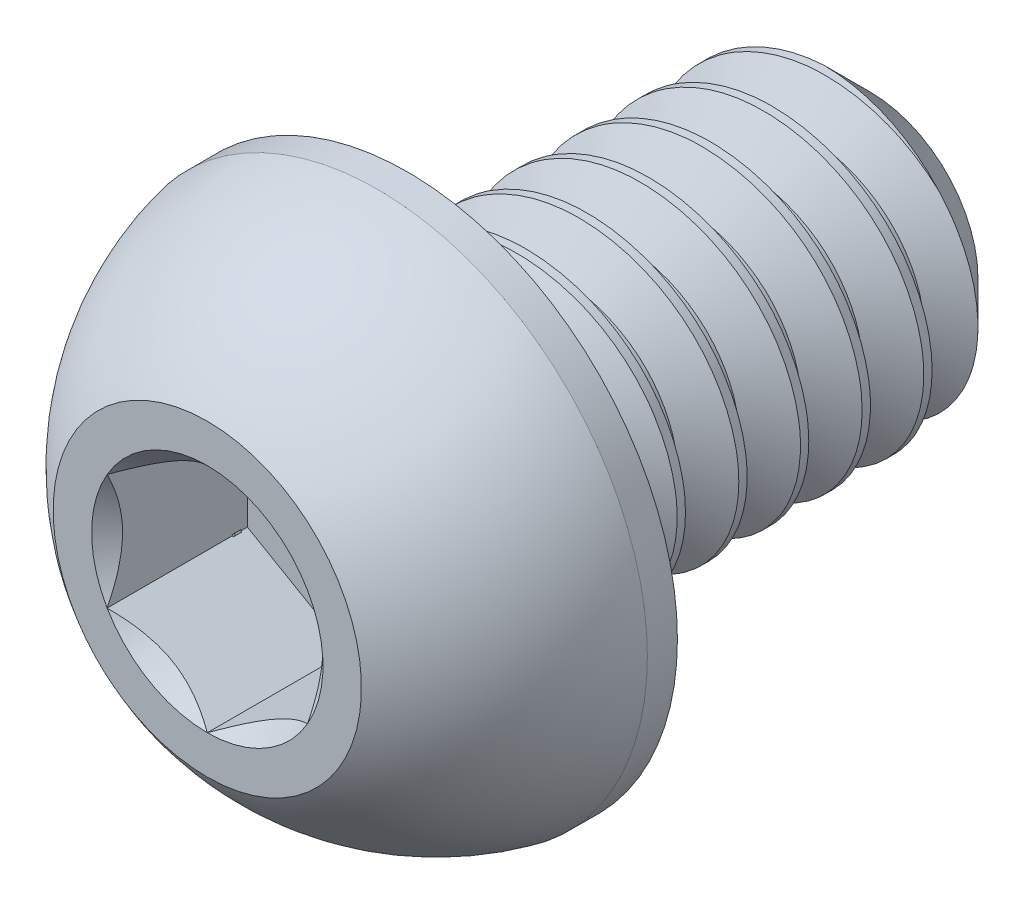
from build123d import *

# Parameters (mm, degrees)
SKETCH1_W          = 3
SKETCH1_H          = 1
CHAMFER1_SIZE      = 0.3
CUT_EXTRUDE2_DEPTH = 0.91
CUT_SWEEP1_PITCH   = 0.4


with BuildPart() as part:
    # Sketch1 → Revolve1 (revolve)
    with BuildSketch(Plane(origin=(0, 0, 0), x_dir=(0, 0, -1), z_dir=(1, 0, 0))):
        with Locations((2.8, 0.5)):
            Rectangle(SKETCH1_W, SKETCH1_H)
    revolve(axis=Axis((0, 0, -4.3), (0, 0, 1)))

    # Chamfer1
    chamfer1_edges = [part.edges().sort_by_distance(p)[0] for p in [
        (0, -1, -4.3),
    ]]
    chamfer(chamfer1_edges, length=CHAMFER1_SIZE)

    # Sketch7 → Revolve2 (revolve)
    with BuildSketch(Plane(origin=(0, 0, 0), x_dir=(0, 0, -1), z_dir=(1, 0, 0)), mode=Mode.PRIVATE) as revolve2_sk:
        with BuildLine():
            Line((1.105, 1.75), (1.3, 1.75))
            Line((1.3, 1.75), (1.3, 0))
            Line((1.3, 0), (0, 0))
            Line((0, 0), (0, 1))
            ThreePointArc((0, 1), (0.479976957, 1.481850617), (1.105, 1.75))
        make_face()
    revolve(revolve2_sk.sketch.rotate(Axis((0, 0, 0), (0, 0, -1)), 180), axis=Axis((0, 0, 0), (0, 0, -1)))

    # Sketch5 → Cut-Extrude2 (cut)
    with BuildSketch(Plane.XY):
        Polygon((0.65, -0.375277675), (0.65, 0.375277675), (0, 0.75055535), (-0.65, 0.375277675), (-0.65, -0.375277675), (0, -0.75055535), align=None)
    extrude(amount=-CUT_EXTRUDE2_DEPTH, mode=Mode.SUBTRACT)

    # Cut-Extrude3 cone 1 section (through the dimple's axis) → Cut-Extrude3 (revolve, cut)
    with BuildSketch(Plane(origin=(0, 0, 0), x_dir=(0, -1, 0), z_dir=(1, 0, 0))):
        Polygon((0, 0), (0.75055535, 0), (0, 0.75055535), align=None)
    revolve(axis=Axis((0, 0, 0), (0, 0, -1)), mode=Mode.SUBTRACT)

    # Cut-Sweep1: the profile of Sketch2 profile screwed along a right-hand helix of 8.5 turns, 6 arcs to a turn; built about Z, then put on its axis
    cut_sweep1_z = Axis((0, 0, 0), (0, 0, 1))
    cut_sweep1_corners = [(1.0003, 0, 0.300173205), (1.0003, 0, -0.046173205), (0.747120582, 0, 0.1), (0.747120582, 0, 0.154)]
    with BuildLine(mode=Mode.PRIVATE) as cut_sweep1_profile:
        Line(cut_sweep1_corners[0], cut_sweep1_corners[1])
        Line(cut_sweep1_corners[1], cut_sweep1_corners[2])
        Line(cut_sweep1_corners[2], cut_sweep1_corners[3])
        Line(cut_sweep1_corners[3], cut_sweep1_corners[0])
    cut_sweep1_cap = Face(cut_sweep1_profile.wire())
    cut_sweep1_turn_angles = [0, 30, 60, 90, 120, 150, 180, 210, 240, 270, 300, 330, 360]
    cut_sweep1_turn_weights = [1, 0.8660254037844387, 1, 0.8660254037844387, 1, 0.8660254037844387, 1, 0.8660254037844387, 1, 0.8660254037844387, 1, 0.8660254037844387, 1]
    cut_sweep1_turn_rails = [Edge.make_bspline([Vector(p[0], p[1], 0).rotate(cut_sweep1_z, cut_sweep1_turn_angles[k]) / cut_sweep1_turn_weights[k] + Vector(0, 0, p[2] + CUT_SWEEP1_PITCH * cut_sweep1_turn_angles[k] / 360) for k in range(13)], [0, 0, 0, 1, 1, 2, 2, 3, 3, 4, 4, 5, 5, 6, 6, 6], 2, cut_sweep1_turn_weights) for p in cut_sweep1_corners]
    cut_sweep1_turn_sides = [Face.make_surface_from_curves(cut_sweep1_turn_rails[p[0]], cut_sweep1_turn_rails[p[1]]) for p in [(0, 1), (1, 2), (2, 3), (3, 0)]]
    cut_sweep1_last_angles = [2880, 2910, 2940, 2970, 3000, 3030, 3060]
    cut_sweep1_last_weights = [1, 0.8660254037844387, 1, 0.8660254037844387, 1, 0.8660254037844546, 1]
    cut_sweep1_last_rails = [Edge.make_bspline([Vector(p[0], p[1], 0).rotate(cut_sweep1_z, cut_sweep1_last_angles[k]) / cut_sweep1_last_weights[k] + Vector(0, 0, p[2] + CUT_SWEEP1_PITCH * cut_sweep1_last_angles[k] / 360) for k in range(7)], [0, 0, 0, 1, 1, 2, 2, 3, 3, 3], 2, cut_sweep1_last_weights) for p in cut_sweep1_corners]
    cut_sweep1_last_sides = [Face.make_surface_from_curves(cut_sweep1_last_rails[p[0]], cut_sweep1_last_rails[p[1]]) for p in [(0, 1), (1, 2), (2, 3), (3, 0)]]
    cut_sweep1 = Plane(origin=(0, 0, -4.3), x_dir=(0, 1, 0), z_dir=(0, 0, 1)) * Solid(Shell([*[p.moved(Location((0, 0, CUT_SWEEP1_PITCH * i))) for i in range(8) for p in cut_sweep1_turn_sides], *cut_sweep1_last_sides, cut_sweep1_cap, cut_sweep1_cap.rotate(cut_sweep1_z, 3060).moved(Location((0, 0, CUT_SWEEP1_PITCH * 3060 / 360)))]))
    add(cut_sweep1, mode=Mode.SUBTRACT)


solid = part.part
